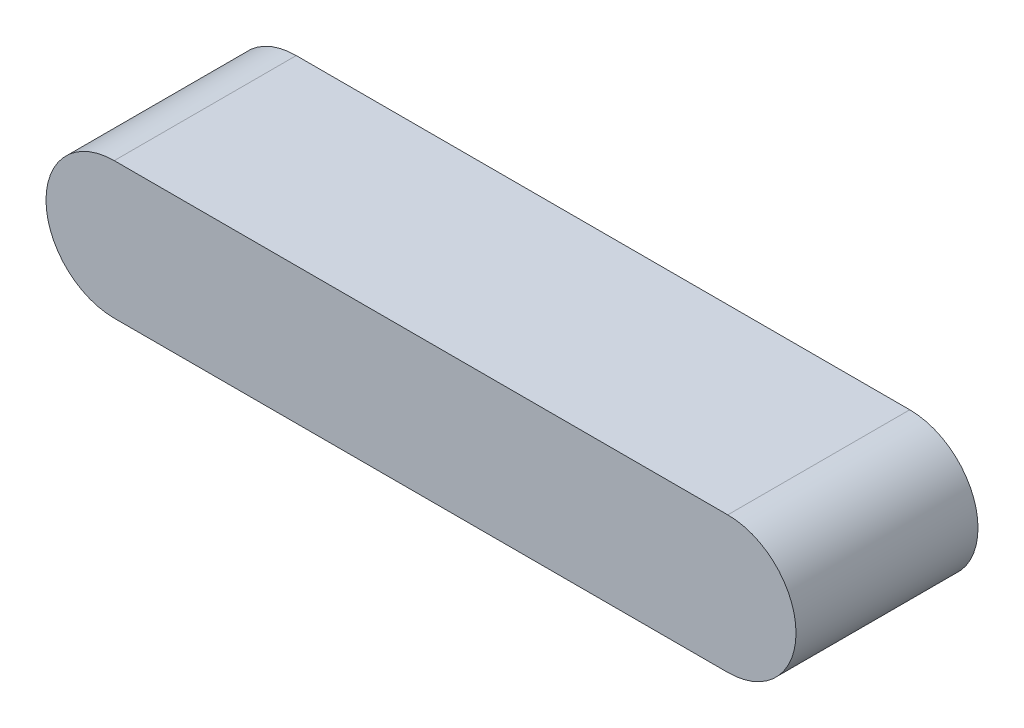
from build123d import *

# Parameters (mm, degrees)
EXTRUDE_1_DEPTH             = 40
SKETCH_2_R                  = 7.25
CUT_EXTRUDE_1_DEPTH         = 1
CHAMFER_1_SIZE              = 0.5
SKETCH_5_R                  = 5.5
CUT_EXTRUDE_2_DEPTH         = 1
CHAMFER_2_SIZE              = 0.5
CHAMFER_2_SIZE2             = 0.288675135
SKETCH_6_R                  = 4.5
CUT_EXTRUDE_3_DEPTH         = 1
CHAMFER_3_SIZE              = 0.5
CHAMFER_3_SIZE2             = 0.866025404
SKETCH_7_R                  = 2.5
CUT_EXTRUDE_4_DEPTH         = 1
CHAMFER_4_SIZE              = 0.5
CHAMFER_4_SIZE2             = 0.866025404
CHAMFER_1_OF_MIRROR_3_SIZE  = 0.5
CHAMFER_2_OF_MIRROR_3_SIZE2 = 0.288675135
CHAMFER_2_OF_MIRROR_3_SIZE  = 0.5
CHAMFER_3_OF_MIRROR_3_SIZE2 = 0.866025404
CHAMFER_3_OF_MIRROR_3_SIZE  = 0.5
CHAMFER_4_OF_MIRROR_3_SIZE2 = 0.5
CHAMFER_4_OF_MIRROR_3_SIZE  = 0.866025404
SKETCH_9_R                  = 7.25
CUT_EXTRUDE_5_DEPTH         = 1
CHAMFER_5_SIZE              = 0.5
SKETCH_10_R                 = 5.6
CUT_EXTRUDE_6_DEPTH         = 1
CHAMFER_6_SIZE              = 0.5
CHAMFER_6_SIZE2             = 0.866025404
SKETCH_11_R                 = 4.35
CUT_EXTRUDE_7_DEPTH         = 1
CHAMFER_7_SIZE              = 0.5
CHAMFER_7_SIZE2             = 0.866025404
SKETCH_12_R                 = 3
CUT_EXTRUDE_8_DEPTH         = 1
CHAMFER_8_SIZE              = 0.5
CHAMFER_8_SIZE2             = 0.866025404
CUT_EXTRUDE_9_DEPTH         = 1.5
FILLET_1_R                  = 1
SKETCH_14_R                 = 2
CUT_EXTRUDE_10_DEPTH        = 1
FILLET_2_R                  = 0.6
SKETCH_15_R                 = 2
CUT_EXTRUDE_11_DEPTH        = 1
FILLET_3_R                  = 0.6
CUT_EXTRUDE_12_DEPTH        = 3
SKETCH_17_W                 = 26
SKETCH_17_H                 = 7
EXTRUDE_2_DEPTH             = 6.5
SKETCH_18_W                 = 6.5
SKETCH_18_H                 = 5
SKETCH_18_W_2               = 5
CUT_EXTRUDE_13_DEPTH        = 3
SKETCH_19_R                 = 1.25
CUT_EXTRUDE_14_DEPTH        = 3


with BuildPart() as part:
    # 草图1 → 凸台-拉伸1 (new body)
    with BuildSketch(Plane.XY):
        with BuildLine():
            Line((-64.7, 15), (70.15, 15))
            ThreePointArc((70.15, 15), (85.15, 0), (70.15, -15))
            Line((70.15, -15), (-64.7, -15))
            ThreePointArc((-64.7, -15), (-79.7, 0), (-64.7, 15))
        make_face()
    extrude(amount=EXTRUDE_1_DEPTH)

    # 草图2 → 切除-拉伸1 (cut)
    with BuildSketch(Plane(origin=(0, 0, 0), x_dir=(-1, 0, 0), z_dir=(0, 0, -1))):
        with Locations((-37.5, 0)):
            Circle(SKETCH_2_R)
    cut_extrude_1 = extrude(amount=-CUT_EXTRUDE_1_DEPTH, mode=Mode.SUBTRACT)

    # 倒角1
    chamfer_1_edges = [part.edges().sort_by_distance(p)[0] for p in [
        (44.75, 0, 1),
        (44.75, 0, 0),
    ]]
    chamfer(chamfer_1_edges, length=CHAMFER_1_SIZE - 0.0001)  # a hair under: the kernel refuses the full size

    # 草图5 → 切除-拉伸2 (cut)
    with BuildSketch(Plane(origin=(0, 0, 1), x_dir=(-1, 0, 0), z_dir=(0, 0, -1))):
        with Locations((-37.5, 0)):
            Circle(SKETCH_5_R)
    cut_extrude_2 = extrude(amount=-CUT_EXTRUDE_2_DEPTH, mode=Mode.SUBTRACT)

    # 倒角2
    chamfer_2_edges = [part.edges().sort_by_distance(p)[0] for p in [
        (43, 0, 1),
    ]]
    chamfer_2_side = [part.faces().sort_by_distance(p)[0] for p in [
        (43, 0, 1.5),
    ]]
    chamfer(chamfer_2_edges, length=CHAMFER_2_SIZE, length2=CHAMFER_2_SIZE2, reference=chamfer_2_side[0])

    # 草图6 → 切除-拉伸3 (cut)
    with BuildSketch(Plane(origin=(0, 0, 2), x_dir=(-1, 0, 0), z_dir=(0, 0, -1))):
        with Locations((-37.5, 0)):
            Circle(SKETCH_6_R)
    cut_extrude_3 = extrude(amount=-CUT_EXTRUDE_3_DEPTH, mode=Mode.SUBTRACT)

    # 倒角3
    chamfer_3_edges = [part.edges().sort_by_distance(p)[0] for p in [
        (42, 0, 2),
    ]]
    chamfer_3_side = [part.faces().sort_by_distance(p)[0] for p in [
        (42, 0, 2.5),
    ]]
    chamfer(chamfer_3_edges, length=CHAMFER_3_SIZE, length2=CHAMFER_3_SIZE2, reference=chamfer_3_side[0])

    # 草图7 → 切除-拉伸4 (cut)
    with BuildSketch(Plane(origin=(0, 0, 3), x_dir=(-1, 0, 0), z_dir=(0, 0, -1))):
        with Locations((-37.5, 0)):
            Circle(SKETCH_7_R)
    cut_extrude_4 = extrude(amount=-CUT_EXTRUDE_4_DEPTH, mode=Mode.SUBTRACT)

    # 倒角4
    chamfer_4_edges = [part.edges().sort_by_distance(p)[0] for p in [
        (40, 0, 3),
    ]]
    chamfer_4_side = [part.faces().sort_by_distance(p)[0] for p in [
        (41.872720779, 0, 3),
    ]]
    chamfer(chamfer_4_edges, length=CHAMFER_4_SIZE, length2=CHAMFER_4_SIZE2, reference=chamfer_4_side[0])

    # 镜向3: 切除-拉伸1, 切除-拉伸2, 切除-拉伸3, 切除-拉伸4 across plane
    add(cut_extrude_1.mirror(Plane(origin=(0, 0, 0), x_dir=(0, 0, 1), z_dir=(1, 0, 0))), mode=Mode.SUBTRACT)
    add(cut_extrude_2.mirror(Plane(origin=(0, 0, 0), x_dir=(0, 0, 1), z_dir=(1, 0, 0))), mode=Mode.SUBTRACT)
    add(cut_extrude_3.mirror(Plane(origin=(0, 0, 0), x_dir=(0, 0, 1), z_dir=(1, 0, 0))), mode=Mode.SUBTRACT)
    add(cut_extrude_4.mirror(Plane(origin=(0, 0, 0), x_dir=(0, 0, 1), z_dir=(1, 0, 0))), mode=Mode.SUBTRACT)

    # 倒角1 of 镜向3
    chamfer_1_of_mirror_3_edges = [part.edges().sort_by_distance(p)[0] for p in [
        (-44.75, 0, 1),
        (-44.75, 0, 0),
    ]]
    chamfer(chamfer_1_of_mirror_3_edges, length=CHAMFER_1_OF_MIRROR_3_SIZE - 0.0001)  # a hair under: the kernel refuses the full size

    # 倒角2 of 镜向3
    chamfer_2_of_mirror_3_edges = [part.edges().sort_by_distance(p)[0] for p in [
        (-43, 0, 1),
    ]]
    chamfer(chamfer_2_of_mirror_3_edges, length=CHAMFER_2_OF_MIRROR_3_SIZE, length2=CHAMFER_2_OF_MIRROR_3_SIZE2)

    # 倒角3 of 镜向3
    chamfer_3_of_mirror_3_edges = [part.edges().sort_by_distance(p)[0] for p in [
        (-42, 0, 2),
    ]]
    chamfer(chamfer_3_of_mirror_3_edges, length=CHAMFER_3_OF_MIRROR_3_SIZE, length2=CHAMFER_3_OF_MIRROR_3_SIZE2)

    # 倒角4 of 镜向3
    chamfer_4_of_mirror_3_edges = [part.edges().sort_by_distance(p)[0] for p in [
        (-40, 0, 3),
    ]]
    chamfer(chamfer_4_of_mirror_3_edges, length=CHAMFER_4_OF_MIRROR_3_SIZE, length2=CHAMFER_4_OF_MIRROR_3_SIZE2)

    # 草图9 → 切除-拉伸5 (cut)
    with BuildSketch(Plane(origin=(0, 0, 0), x_dir=(-1, 0, 0), z_dir=(0, 0, -1))):
        with Locations((12.5, 0)):
            Circle(SKETCH_9_R)
    extrude(amount=-CUT_EXTRUDE_5_DEPTH, mode=Mode.SUBTRACT)

    # 倒角5
    chamfer_5_edges = [part.edges().sort_by_distance(p)[0] for p in [
        (-5.25, 0, 1),
    ]]
    chamfer(chamfer_5_edges, length=CHAMFER_5_SIZE)

    # 草图10 → 切除-拉伸6 (cut)
    with BuildSketch(Plane(origin=(0, 0, 1), x_dir=(-1, 0, 0), z_dir=(0, 0, -1))):
        with Locations((12.5, 0)):
            Circle(SKETCH_10_R)
    extrude(amount=-CUT_EXTRUDE_6_DEPTH, mode=Mode.SUBTRACT)

    # 倒角6
    chamfer_6_edges = [part.edges().sort_by_distance(p)[0] for p in [
        (-6.9, 0, 1),
    ]]
    chamfer_6_side = [part.faces().sort_by_distance(p)[0] for p in [
        (-6.9, 0, 1.5),
    ]]
    chamfer(chamfer_6_edges, length=CHAMFER_6_SIZE, length2=CHAMFER_6_SIZE2, reference=chamfer_6_side[0])

    # 草图11 → 切除-拉伸7 (cut)
    with BuildSketch(Plane(origin=(0, 0, 2), x_dir=(-1, 0, 0), z_dir=(0, 0, -1))):
        with Locations((12.5, 0)):
            Circle(SKETCH_11_R)
    extrude(amount=-CUT_EXTRUDE_7_DEPTH, mode=Mode.SUBTRACT)

    # 倒角7
    chamfer_7_edges = [part.edges().sort_by_distance(p)[0] for p in [
        (-8.15, 0, 2),
    ]]
    chamfer_7_side = [part.faces().sort_by_distance(p)[0] for p in [
        (-8.15, 0, 2.5),
    ]]
    chamfer(chamfer_7_edges, length=CHAMFER_7_SIZE, length2=CHAMFER_7_SIZE2, reference=chamfer_7_side[0])

    # 草图12 → 切除-拉伸8 (cut)
    with BuildSketch(Plane(origin=(0, 0, 3), x_dir=(-1, 0, 0), z_dir=(0, 0, -1))):
        with Locations((12.5, 0)):
            Circle(SKETCH_12_R)
    extrude(amount=-CUT_EXTRUDE_8_DEPTH, mode=Mode.SUBTRACT)

    # 倒角8
    chamfer_8_edges = [part.edges().sort_by_distance(p)[0] for p in [
        (-9.5, 0, 4),
    ]]
    chamfer_8_side = [part.faces().sort_by_distance(p)[0] for p in [
        (-9.5, 0, 3.5),
    ]]
    chamfer(chamfer_8_edges, length=CHAMFER_8_SIZE, length2=CHAMFER_8_SIZE2, reference=chamfer_8_side[0])

    # 草图13 → 切除-拉伸9 (cut)
    with BuildSketch(Plane(origin=(0, 0, 0), x_dir=(-1, 0, 0), z_dir=(0, 0, -1))):
        with BuildLine():
            Line((-70.249806967, 12.989941679), (64.685358142, 12.989941679))
            ThreePointArc((64.685358142, 12.989941679), (77.675299821, 0), (64.685358142, -12.989941679))
            Line((64.685358142, -12.989941679), (-70.249806967, -12.989941679))
            ThreePointArc((-70.249806967, -12.989941679), (-83.239748646, 0), (-70.249806967, 12.989941679))
        make_face()
    extrude(amount=-CUT_EXTRUDE_9_DEPTH, mode=Mode.SUBTRACT)

    # 圆角1
    fillet_1_edges = [part.edges().sort_by_distance(p)[0] for p in [
        (83.239748646, 0, 1.5),
        (2.782224413, 12.989941679, 1.5),
        (-77.675299821, 0, 1.5),
        (2.782224413, -12.989941679, 1.5),
    ]]
    fillet(fillet_1_edges, radius=FILLET_1_R)

    # 草图14 → 切除-拉伸10 (cut)
    with BuildSketch(Plane(origin=(0, 0, 1.5), x_dir=(-1, 0, 0), z_dir=(0, 0, -1))):
        with Locations((-24.5, 4.5)):
            Circle(SKETCH_14_R)
    extrude(amount=-CUT_EXTRUDE_10_DEPTH, mode=Mode.SUBTRACT)

    # 圆角2
    fillet_2_edges = [part.edges().sort_by_distance(p)[0] for p in [
        (26.5, 4.5, 2.5),
    ]]
    fillet(fillet_2_edges, radius=FILLET_2_R)

    # 草图15 → 切除-拉伸11 (cut)
    with BuildSketch(Plane(origin=(0, 0, 1.5), x_dir=(-1, 0, 0), z_dir=(0, 0, -1))):
        with Locations((-24.5, -4.5)):
            Circle(SKETCH_15_R)
    extrude(amount=-CUT_EXTRUDE_11_DEPTH, mode=Mode.SUBTRACT)

    # 圆角3
    fillet_3_edges = [part.edges().sort_by_distance(p)[0] for p in [
        (26.5, -4.5, 2.5),
    ]]
    fillet(fillet_3_edges, radius=FILLET_3_R)

    # 草图16 → 切除-拉伸12 (cut)
    with BuildSketch(Plane(origin=(0, 0, 1.5), x_dir=(-1, 0, 0), z_dir=(0, 0, -1))):
        with BuildLine():
            ThreePointArc((-59.831299631, 1.114743341), (-60.893840639, -0.011454355), (-59.767642942, -1.073995363))
            ThreePointArc((-59.767642942, -1.073995363), (-59.385256659, -0.668700369), (-59.790551653, -0.286314086))
            ThreePointArc((-59.790551653, -0.286314086), (-60.106159361, 0.011454355), (-59.80839092, 0.327062064))
            ThreePointArc((-59.80839092, 0.327062064), (-59.426004637, 0.732357058), (-59.831299631, 1.114743341))
        make_face()
    cut_extrude_12 = extrude(amount=-CUT_EXTRUDE_12_DEPTH, mode=Mode.SUBTRACT)

    # 镜向6: 切除-拉伸12 across plane
    add(cut_extrude_12.mirror(Plane(origin=(0, 0, 0), x_dir=(0, 0, 1), z_dir=(1, 0, 0))), mode=Mode.SUBTRACT)

    # 草图17 → 凸台-拉伸2 (add)
    with BuildSketch(Plane.XZ.offset(15)):
        with Locations((0, 10.5)):
            Rectangle(SKETCH_17_W, SKETCH_17_H)
    extrude(amount=EXTRUDE_2_DEPTH)

    # 草图18 → 切除-拉伸13 (cut)
    with BuildSketch(Plane.XZ.offset(21.5)):
        with Locations((-9.75, 10.5)):
            Rectangle(SKETCH_18_W, SKETCH_18_H)
        with Locations((9.75, 10.5)):
            Rectangle(SKETCH_18_W, SKETCH_18_H)
        with Locations((-3, 10.5)):
            Rectangle(SKETCH_18_W_2, SKETCH_18_H)
        with Locations((3, 10.5)):
            Rectangle(SKETCH_18_W_2, SKETCH_18_H)
    extrude(amount=-CUT_EXTRUDE_13_DEPTH, mode=Mode.SUBTRACT)

    # 草图19 → 切除-拉伸14 (cut)
    with BuildSketch(Plane.XZ.offset(18.5)):
        with Locations(Location((9, 11, 0), (0, 0, 270))):
            Circle(SKETCH_19_R)
        with Locations(Location((-9.7, 11, 0), (0, 0, 270))):
            Circle(SKETCH_19_R)
    extrude(amount=-CUT_EXTRUDE_14_DEPTH, mode=Mode.SUBTRACT)


solid = part.part
